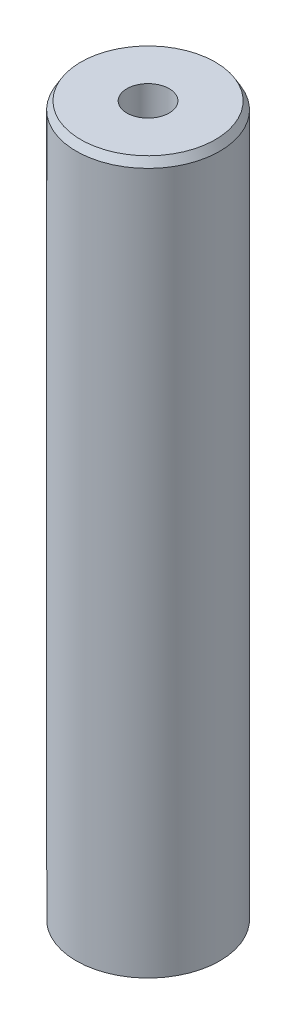
from build123d import *
from OCP.BRepFilletAPI import BRepFilletAPI_MakeChamfer

# Parameters (mm, degrees)
SKETCH1_R           = 17.5
BOSS_EXTRUDE1_DEPTH = 174.013878562
SKETCH2_R           = 5.158446425
CUT_EXTRUDE1_DEPTH  = 176.764984944
CHAMFER1_SIZE       = 1.896887559
CHAMFER1_SIZE2      = 1.095168543


with BuildPart() as part:
    # Sketch1 → Boss-Extrude1 (new body)
    with BuildSketch(Plane(origin=(0, 0, 0), x_dir=(1, 0, 0), z_dir=(0, 1, 0))):
        Circle(SKETCH1_R)
    extrude(amount=BOSS_EXTRUDE1_DEPTH)

    # Sketch2 → Cut-Extrude1 (cut, through all)
    with BuildSketch(Plane(origin=(0, 0, 0), x_dir=(1, 0, 0), z_dir=(0, 1, 0))):
        Circle(SKETCH2_R)
    extrude(amount=CUT_EXTRUDE1_DEPTH, mode=Mode.SUBTRACT)

    # Chamfer1: one chamfer whose edges measure the first distance from different faces: ONE call of the kernel's chamfer builder (chamfer() names one face for all edges)
    chamfer1_edges_1 = [part.edges().sort_by_distance(p)[0] for p in [
        (-17.5, 174.013878562, 0),
    ]]
    chamfer1_side_1 = [part.faces().sort_by_distance(p)[0] for p in [
        (-17.5, 87.006939281, 0),
    ]]
    chamfer1_edges_2 = [part.edges().sort_by_distance(p)[0] for p in [
        (-17.5, 0, 0),
    ]]
    chamfer1_side_2 = [part.faces().sort_by_distance(p)[0] for p in [
        (-17.005025253, 0, 0),
    ]]
    chamfer1 = BRepFilletAPI_MakeChamfer(part.part.solid().wrapped)
    for e in chamfer1_edges_1:
        chamfer1.Add(CHAMFER1_SIZE, CHAMFER1_SIZE2, e.wrapped, chamfer1_side_1[0].wrapped)  # the first distance lies on this face
    for e in chamfer1_edges_2:
        chamfer1.Add(CHAMFER1_SIZE, CHAMFER1_SIZE2, e.wrapped, chamfer1_side_2[0].wrapped)  # the first distance lies on this face
    add(Compound.cast(chamfer1.Shape()), mode=Mode.REPLACE)


solid = part.part
